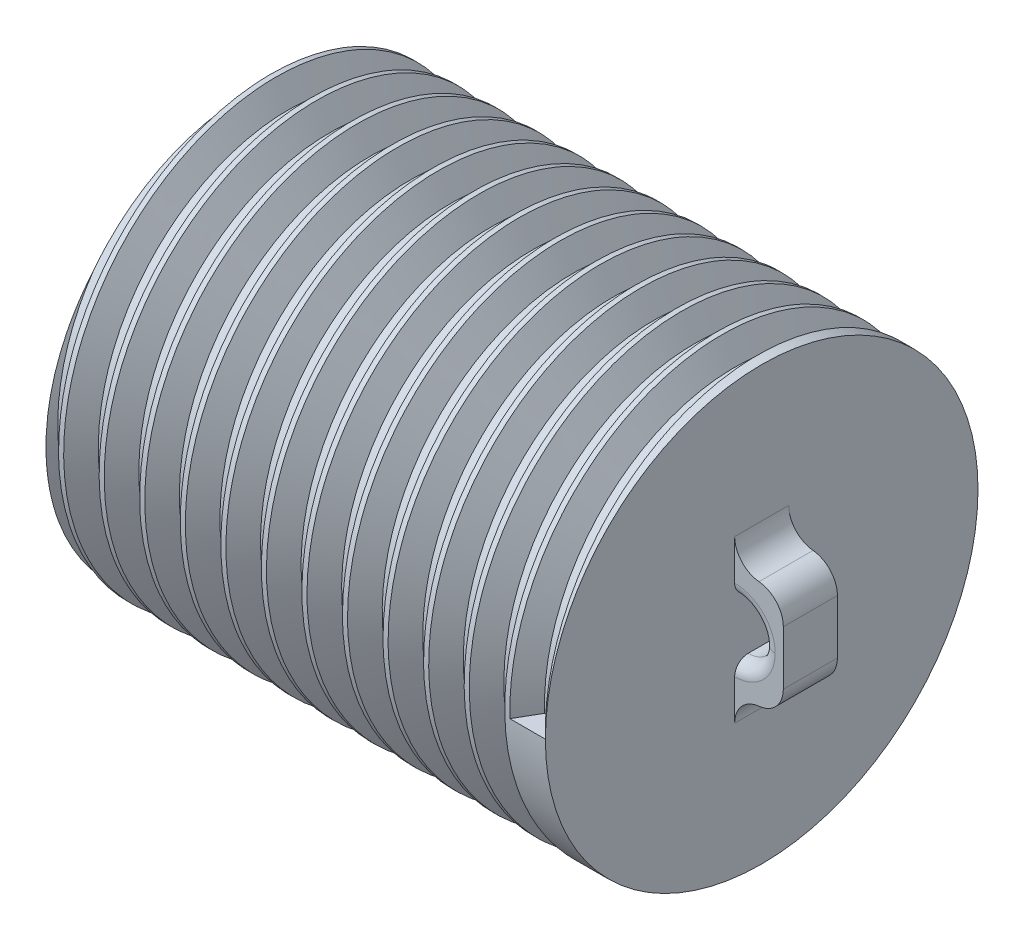
from build123d import *

# Parameters (mm, degrees)
SKETCH1_R           = 8
BOSS_EXTRUDE1_DEPTH = 19
SKETCH2_W           = 1.999996
SKETCH2_H           = 4
BOSS_EXTRUDE2_DEPTH = 1.8
SKETCH3_W           = 1
SKETCH3_H           = 2
CUT_EXTRUDE1_DEPTH  = 25.034141632
FILLET1_R           = 1
FILLET2_R           = 1
FILLET3_R           = 0.5
FILLET4_R           = 1
THREAD1_PITCH       = 1.5


# Some blends are built 0.0001 mm under size
with BuildPart() as part:
    # Sketch1 → Boss-Extrude1 (new body)
    with BuildSketch(Plane(origin=(0, 0, 0), x_dir=(0, 0, -1), z_dir=(1, 0, 0))):
        Circle(SKETCH1_R)
    extrude(amount=BOSS_EXTRUDE1_DEPTH)

    # Sketch2 → Boss-Extrude2 (add)
    with BuildSketch(Plane(origin=(19, 0, 0), x_dir=(0, 0, -1), z_dir=(1, 0, 0))):
        Rectangle(SKETCH2_W, SKETCH2_H)
    extrude(amount=BOSS_EXTRUDE2_DEPTH)

    # Sketch3 → Cut-Extrude1 (cut, through all)
    with BuildSketch(Plane.XY.offset(0.999998)):
        with Locations((19.5, 0)):
            Rectangle(SKETCH3_W, SKETCH3_H)
    extrude(amount=-CUT_EXTRUDE1_DEPTH, mode=Mode.SUBTRACT)

    # Fillet1
    fillet1_edges = [part.edges().sort_by_distance(p)[0] for p in [
        (20.8, -2, 0),
        (20.8, 2, 0),
    ]]
    fillet(fillet1_edges, radius=FILLET1_R)

    # Fillet2
    fillet2_edges = [part.edges().sort_by_distance(p)[0] for p in [
        (20, -1, 0),
        (20, 1, 0),
    ]]
    fillet(fillet2_edges, radius=FILLET2_R - 0.0001)  # a hair under: the kernel refuses the full size

    # Fillet3
    fillet3_edges = [part.edges().sort_by_distance(p)[0] for p in [
        (19.707136071, -0.707136071, 0.999998),
        (19.707136071, -0.707136071, -0.999998),
        (19.707136071, 0.707136071, 0.999998),
        (19.707136071, 0.707136071, -0.999998),
    ]]
    fillet(fillet3_edges, radius=FILLET3_R)

    # Fillet4
    # the kernel refuses this fillet: 1 mm, written as the material it adds along each edge
    with BuildSketch(Plane(origin=(19, 2, -0.999998), x_dir=(0, 1, 0), z_dir=(0, 0, 1)), Plane(origin=(19, -2, 0.999998), x_dir=(0, -1, 0), z_dir=(0, 0, -1))) as fillet4_piece_1:
        with BuildLine():
            CenterArc((0.989974874, -1), FILLET4_R, 90, 84.260829523)
            Line((-0.005012563, -0.9), (-0.104511307, -0.89))
            ThreePointArc((-0.104511307, -0.89), (-0.1, -0.8), (-0.1, 0))
            Line((-0.1, 0), (0, 0.1))
            Line((0, 0.1), (0.989974874, 0.1))
            Line((0.989974874, 0.1), (0.989974874, 0))
        make_face()
    extrude(amount=1.999996)

    # Thread1: the profile of Thread Profile1 profile screwed along a right-hand helix of 12.666667 turns, 8 arcs to a turn; built about Z, then put on its axis
    thread1_z = Axis((0, 0, 0), (0, 0, 1))
    thread1_corners = [(8.0003, 0, -0.000173205), (8.0003, 0, 1.312673201), (7.188101188, 0, 0.843749998), (7.188101188, 0, 0.468749998)]
    with BuildLine(mode=Mode.PRIVATE) as thread1_profile:
        Line(thread1_corners[0], thread1_corners[1])
        Line(thread1_corners[1], thread1_corners[2])
        Line(thread1_corners[2], thread1_corners[3])
        Line(thread1_corners[3], thread1_corners[0])
    thread1_cap = Face(thread1_profile.wire())
    thread1_turn_angles = [0, 22.5, 45, 67.5, 90, 112.5, 135, 157.5, 180, 202.5, 225, 247.5, 270, 292.5, 315, 337.5, 360]
    thread1_turn_weights = [1, 0.9238795325112867, 1, 0.9238795325112867, 1, 0.9238795325112867, 1, 0.9238795325112867, 1, 0.9238795325112867, 1, 0.9238795325112867, 1, 0.9238795325112867, 1, 0.9238795325112867, 1]
    thread1_turn_rails = [Edge.make_bspline([Vector(p[0], p[1], 0).rotate(thread1_z, thread1_turn_angles[k]) / thread1_turn_weights[k] + Vector(0, 0, p[2] + THREAD1_PITCH * thread1_turn_angles[k] / 360) for k in range(17)], [0, 0, 0, 1, 1, 2, 2, 3, 3, 4, 4, 5, 5, 6, 6, 7, 7, 8, 8, 8], 2, thread1_turn_weights) for p in thread1_corners]
    thread1_turn_sides = [Face.make_surface_from_curves(thread1_turn_rails[p[0]], thread1_turn_rails[p[1]]) for p in [(0, 1), (1, 2), (2, 3), (3, 0)]]
    thread1_last_angles = [4320, 4342.5, 4365, 4387.5, 4410, 4432.5, 4455, 4477.5, 4500, 4522.5, 4545, 4552.5, 4560]
    thread1_last_weights = [1, 0.9238795325112867, 1, 0.9238795325112867, 1, 0.9238795325112867, 1, 0.9238795325112867, 1, 0.9238795325112867, 1, 0.9914448613738115, 1]
    thread1_last_rails = [Edge.make_bspline([Vector(p[0], p[1], 0).rotate(thread1_z, thread1_last_angles[k]) / thread1_last_weights[k] + Vector(0, 0, p[2] + THREAD1_PITCH * thread1_last_angles[k] / 360) for k in range(13)], [0, 0, 0, 1, 1, 2, 2, 3, 3, 4, 4, 5, 5, 6, 6, 6], 2, thread1_last_weights) for p in thread1_corners]
    thread1_last_sides = [Face.make_surface_from_curves(thread1_last_rails[p[0]], thread1_last_rails[p[1]]) for p in [(0, 1), (1, 2), (2, 3), (3, 0)]]
    thread1 = Plane(origin=(19, 0, 0), x_dir=(0, 0, 1), z_dir=(-1, 0, 0)) * Solid(Shell([*[p.moved(Location((0, 0, THREAD1_PITCH * i))) for i in range(12) for p in thread1_turn_sides], *thread1_last_sides, thread1_cap, thread1_cap.rotate(thread1_z, 4560).moved(Location((0, 0, THREAD1_PITCH * 4560 / 360)))]))
    add(thread1, mode=Mode.SUBTRACT)


solid = part.part
